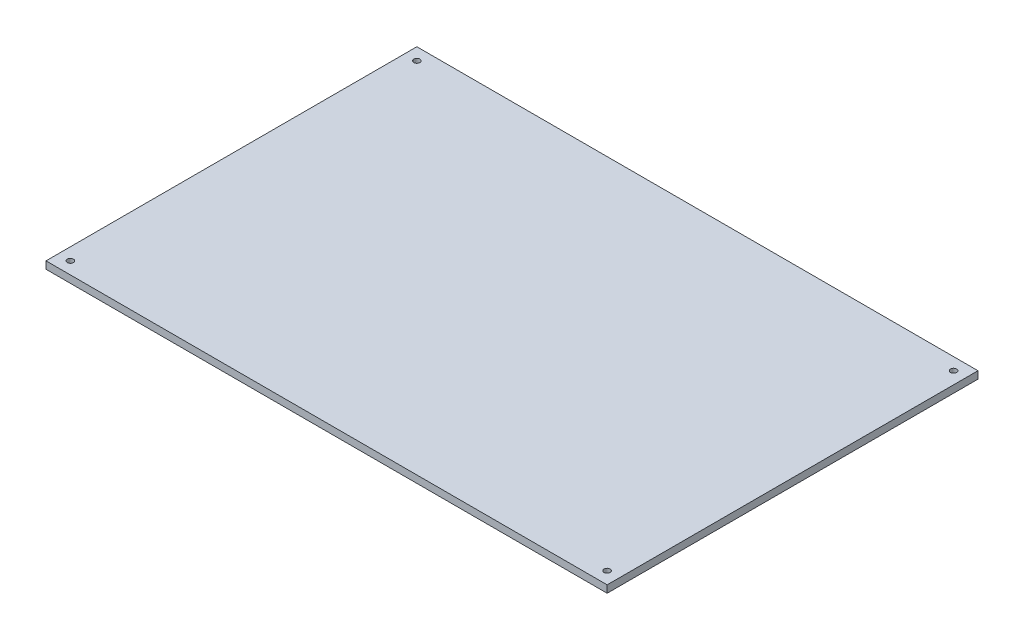
from build123d import *

# Parameters (mm, degrees)
SKETCH_1_W          = 230
SKETCH_1_H          = 152
EXTRUDE_1_DEPTH     = 3
SKETCH_2_R          = 1.25
CUT_EXTRUDE_1_DEPTH = 3


with BuildPart() as part:
    # Эскиз1 → Бобышка-Вытянуть1 (new body)
    with BuildSketch(Plane(origin=(0, 0, 0), x_dir=(1, 0, 0), z_dir=(0, 1, 0))):
        with Locations((-38.903225806, -30.5)):
            Rectangle(SKETCH_1_W, SKETCH_1_H)
    extrude(amount=EXTRUDE_1_DEPTH)

    # Эскиз2 → Вырез-Вытянуть1 (cut)
    with BuildSketch(Plane(origin=(0, 3, 0), x_dir=(1, 0, 0), z_dir=(0, 1, 0))):
        with Locations((-148.903225806, 40.5)):
            Circle(SKETCH_2_R)
        with Locations((71.096774194, 40.5)):
            Circle(SKETCH_2_R)
        with Locations((71.096774194, -101.5)):
            Circle(SKETCH_2_R)
        with Locations((-148.903225806, -101.5)):
            Circle(SKETCH_2_R)
    extrude(amount=-CUT_EXTRUDE_1_DEPTH, mode=Mode.SUBTRACT)


solid = part.part
